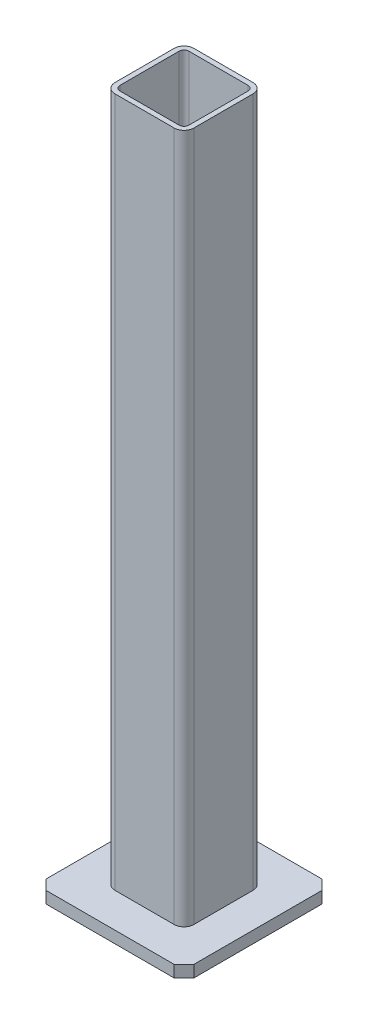
from build123d import *

# Parameters (mm, degrees)
SQUARE_TUBE_80_X_80_X_5_1_DEPTH = 700
SKETCH12_W                      = 150
SKETCH12_H                      = 150
BASE_FLANGE1_DEPTH              = 12
BREAK_CORNER1_START             = -12
BREAK_CORNER1_DEPTH             = 12


# Read off the part's stored shape, not the designer's step: Break-Corner1
# Sheet-metal steps are written as plain solids
with BuildPart() as part:
    # Sketch11 → Square tube 80 X 80 X 5(1) (new body)
    with BuildSketch(Plane(origin=(0, 0, 0), x_dir=(-1, 0, 0), z_dir=(0, 1, 0))):
        with BuildLine():
            Line((-30, -40), (30, -40))
            ThreePointArc((30, -40), (37.071067812, -37.071067812), (40, -30))
            Line((40, -30), (40, 30))
            ThreePointArc((40, 30), (37.071067812, 37.071067812), (30, 40))
            Line((30, 40), (-30, 40))
            ThreePointArc((-30, 40), (-37.071067812, 37.071067812), (-40, 30))
            Line((-40, 30), (-40, -30))
            ThreePointArc((-40, -30), (-37.071067812, -37.071067812), (-30, -40))
        make_face()
        with BuildLine():
            Line((-30, -35), (30, -35))
            ThreePointArc((30, -35), (33.535533906, -33.535533906), (35, -30))
            Line((35, -30), (35, 30))
            ThreePointArc((35, 30), (33.535533906, 33.535533906), (30, 35))
            Line((30, 35), (-30, 35))
            ThreePointArc((-30, 35), (-33.535533906, 33.535533906), (-35, 30))
            Line((-35, 30), (-35, -30))
            ThreePointArc((-35, -30), (-33.535533906, -33.535533906), (-30, -35))
        make_face(mode=Mode.SUBTRACT)
    extrude(amount=SQUARE_TUBE_80_X_80_X_5_1_DEPTH)


with BuildPart() as body_2:
    # Sketch12 → Base-Flange1 (new body)
    with BuildSketch(Plane.XZ):
        Rectangle(SKETCH12_W, SKETCH12_H)
    extrude(amount=BASE_FLANGE1_DEPTH)

    # Break-Corner1 outline → Break-Corner1 (cut)
    with BuildSketch(Plane(origin=(0, 0, 0), x_dir=(1, 0, 0), z_dir=(0, 1, 0)).offset(BREAK_CORNER1_START)):
        Polygon((75, -75), (75, -65), (65, -75), align=None)
        Polygon((65, 75), (75, 65), (75, 75), align=None)
        Polygon((-75, -75), (-65, -75), (-75, -65), align=None)
        Polygon((-75, 65), (-65, 75), (-75, 75), align=None)
    extrude(amount=BREAK_CORNER1_DEPTH, mode=Mode.SUBTRACT)


solid = Compound([part.part, body_2.part])
